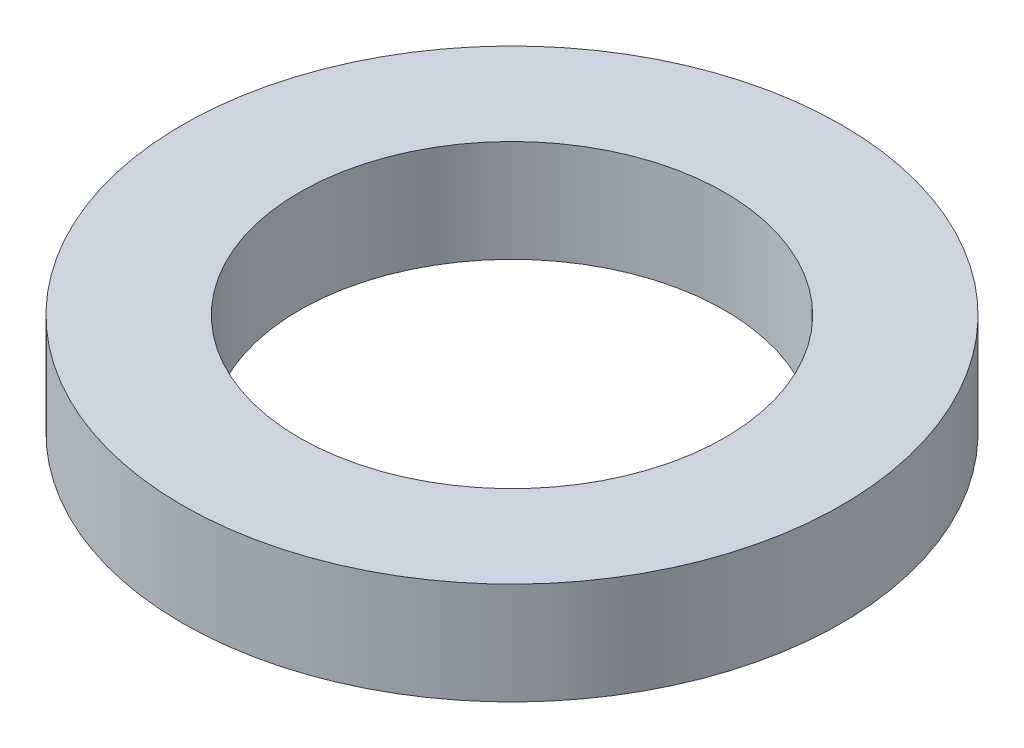
from build123d import *

# Parameters (mm, degrees)
SKETCH1_R           = 77.5
BOSS_EXTRUDE1_DEPTH = 24
SKETCH2_R           = 50
CUT_EXTRUDE1_DEPTH  = 113.198484838


with BuildPart() as part:
    # Sketch1 → Boss-Extrude1 (new body)
    with BuildSketch(Plane(origin=(0, 0, 0), x_dir=(1, 0, 0), z_dir=(0, 1, 0))):
        Circle(SKETCH1_R)
    extrude(amount=BOSS_EXTRUDE1_DEPTH)

    # Sketch2 → Cut-Extrude1 (cut, through all)
    with BuildSketch(Plane(origin=(0, 0, 0), x_dir=(1, 0, 0), z_dir=(0, 1, 0))):
        Circle(SKETCH2_R)
    extrude(amount=CUT_EXTRUDE1_DEPTH, mode=Mode.SUBTRACT)


solid = part.part
